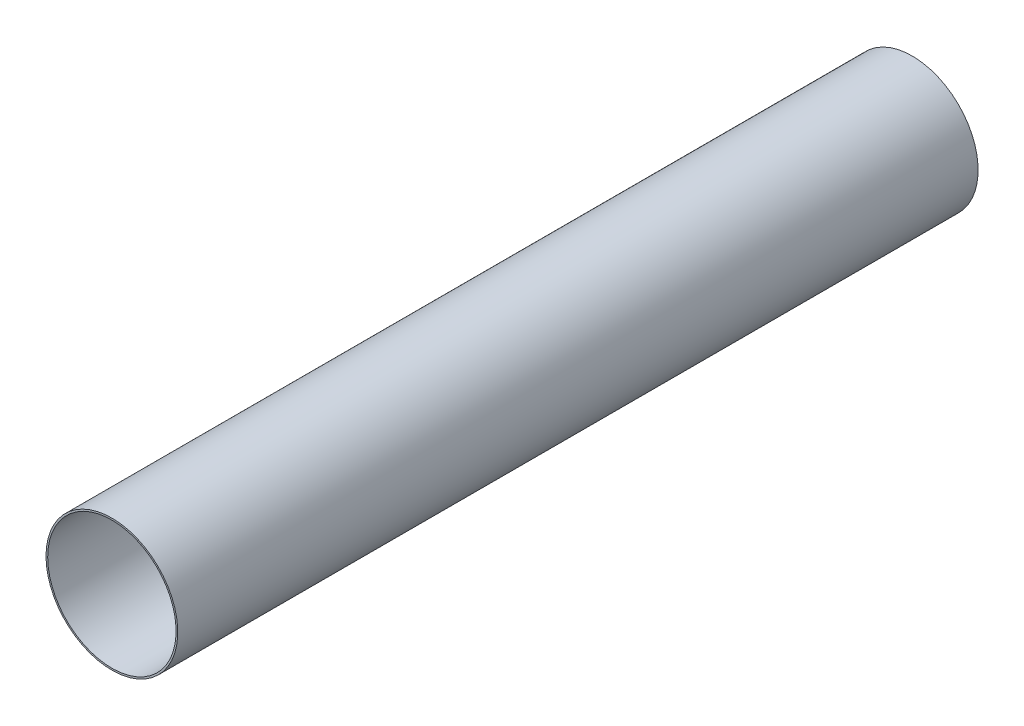
from build123d import *

# Parameters (mm, degrees)
SKETCH1_R           = 78.2
SKETCH1_R_2         = 76.2
BOSS_EXTRUDE1_DEPTH = 950


with BuildPart() as part:
    # Sketch1 → Boss-Extrude1 (new body)
    with BuildSketch(Plane.XY):
        Circle(SKETCH1_R)
        Circle(SKETCH1_R_2, mode=Mode.SUBTRACT)
    extrude(amount=BOSS_EXTRUDE1_DEPTH)


solid = part.part
